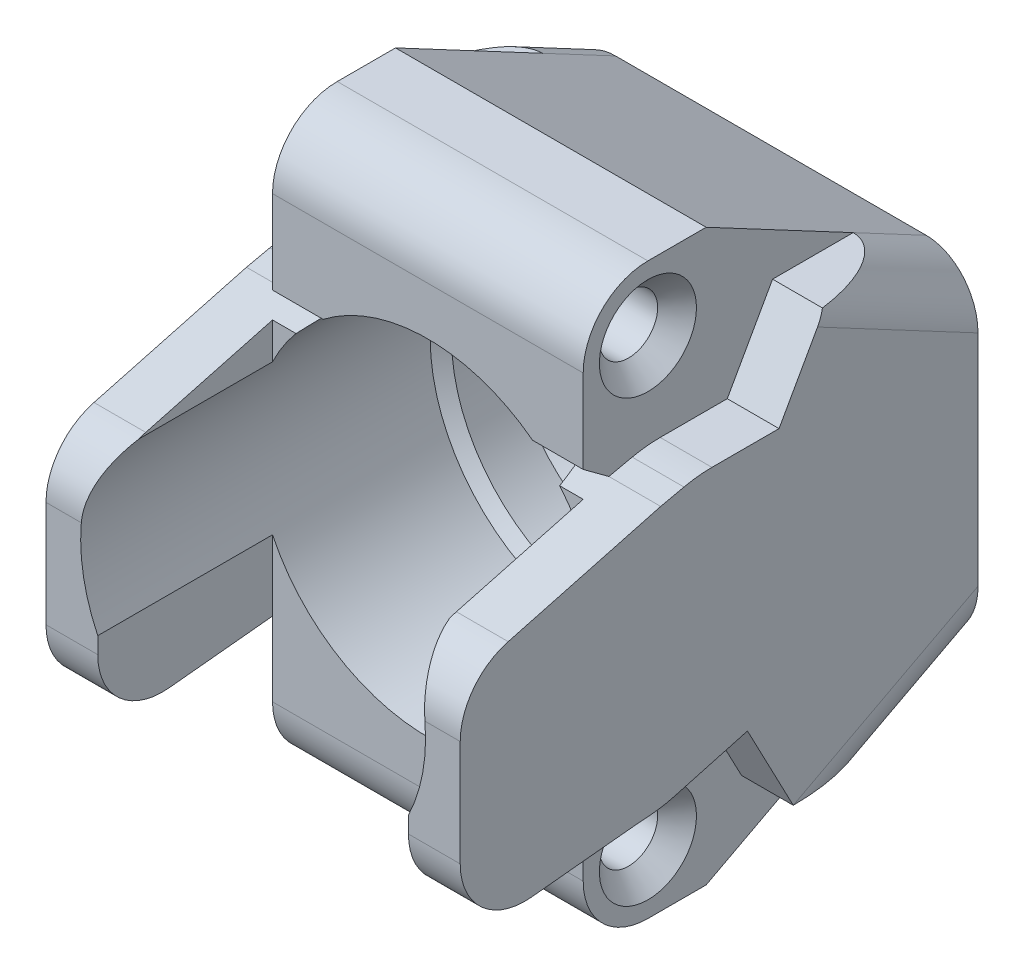
from build123d import *

# Parameters (mm, degrees)
BOSS_EXTRUDE1_DEPTH           = 16
SKETCH2_W                     = 4
SKETCH2_H                     = 6.039060338
CUT_EXTRUDE1_DEPTH            = 49.391321349
FILLET1_R                     = 4
CUT_EXTRUDE2_DEPTH            = 4
SKETCH4_R                     = 12.5
CUT_EXTRUDE3_DEPTH            = 5
SKETCH5_R                     = 11.435
CUT_EXTRUDE4_DEPTH            = 45.34771704
CUT_EXTRUDE5_START            = -2
SKETCH7_R                     = 12.5
CUT_EXTRUDE5_DEPTH            = 43.347717155
CUT_EXTRUDE6_START            = 5
SKETCH8_R                     = 13.322
CUT_EXTRUDE6_DEPTH            = 38.786914196
CHAMFER5_SIZE                 = 1
SKETCH9_W                     = 24
SKETCH9_H                     = 20
CUT_EXTRUDE7_DEPTH            = 59.111966759
CSK_FOR_M4_SFHCS1_D           = 4.5
CSK_FOR_M4_SFHCS1_CSINK_D     = 7.5
CSK_FOR_M4_SFHCS1_CSINK_ANGLE = 90


with BuildPart() as part:
    # Sketch1 → Boss-Extrude1 (new, symmetric)
    with BuildSketch(Plane(origin=(0, 0, 0), x_dir=(0, 0, -1), z_dir=(1, 0, 0))):
        with BuildLine():
            Line((0, 13), (0, -13))
            Line((0, -13), (-17, -21.960950792))
            Line((-17, -21.960950792), (-21.5, -21.960950792))
            ThreePointArc((-21.5, -21.960950792), (-25.035533906, -20.496484698), (-26.5, -16.960950792))
            Line((-26.5, -16.960950792), (-26.5, -11.227190102))
            Line((-26.5, -11.227190102), (-34.5, -12.031216319))
            ThreePointArc((-34.5, -12.031216319), (-38.354100408, -10.76437729), (-39.999997516, -7.056278884))
            Line((-39.999997516, -7.056278884), (-39.999997516, 1.132402994))
            ThreePointArc((-39.999997516, 1.132402994), (-38.966764217, 4.176210139), (-36.294092741, 5.962032125))
            Line((-36.294092741, 5.962032125), (-24.512466398, 9.118909389))
            Line((-24.512466398, 9.118909389), (-26.5, 10.584515032))
            Line((-26.5, 10.584515032), (-26.5, 17.039060338))
            ThreePointArc((-26.5, 17.039060338), (-25.035533906, 20.574594244), (-21.5, 22.039060338))
            Line((-21.5, 22.039060338), (-17, 22.039060338))
            Line((-17, 22.039060338), (0, 13))
        make_face()
    extrude(amount=BOSS_EXTRUDE1_DEPTH, both=True)

    # Sketch2 → Cut-Extrude1 (cut, through all)
    with BuildSketch(Plane(origin=(0, 0, 0), x_dir=(-1, 0, 0), z_dir=(0, 0, -1))):
        with Locations((-14, 19.019530169)):
            Rectangle(SKETCH2_W, SKETCH2_H)
        with Locations((14, 19.019530169)):
            Rectangle(SKETCH2_W, SKETCH2_H)
        with Locations((14, -19.019530169)):
            Rectangle(SKETCH2_W, SKETCH2_H)
        with Locations((-14, -19.019530169)):
            Rectangle(SKETCH2_W, SKETCH2_H)
    extrude(amount=-CUT_EXTRUDE1_DEPTH, mode=Mode.SUBTRACT)

    # Fillet1
    fillet1_edges = [part.edges().sort_by_distance(p)[0] for p in [
        (16, -14.5, 2.845680173),
        (-16, -14.5, 2.845680173),
        (16, 14.5, 2.821089698),
        (-16, 14.5, 2.821089698),
    ]]
    fillet(fillet1_edges, radius=FILLET1_R)

    # Sketch3 → Cut-Extrude2 (cut)
    with BuildSketch(Plane.ZY.offset(16)):
        with BuildLine():
            Line((14.269532395, -16), (17.810147733, -9.256580566))
            Line((17.810147733, -9.256580566), (23.455857772, -10.805790893))
            ThreePointArc((23.455857772, -10.805790893), (24.367969512, -11.010765142), (25.295236814, -11.12966687))
            Line((25.295236814, -11.12966687), (26.5, -11.227190102))
            Line((26.5, -11.227190102), (26.5, -16))
            Line((26.5, -16), (14.269532395, -16))
        make_face()
        with BuildLine():
            Line((11.870259532, 16), (15.370259532, 9.753066737))
            Line((15.370259532, 9.753066737), (20.553734624, 9.753066737))
            ThreePointArc((20.553734624, 9.753066737), (21.64061559, 9.693825703), (22.714618956, 9.516804502))
            Line((22.714618956, 9.516804502), (24.512466398, 9.118909389))
            Line((24.512466398, 9.118909389), (26.5, 10.584515032))
            Line((26.5, 10.584515032), (26.5, 16))
            Line((26.5, 16), (11.870259532, 16))
        make_face()
    cut_extrude2 = extrude(amount=-CUT_EXTRUDE2_DEPTH, mode=Mode.SUBTRACT)

    # Mirror1: Cut-Extrude2 across plane
    add(cut_extrude2.mirror(Plane(origin=(0, 0, 0), x_dir=(0, 0, 1), z_dir=(1, 0, 0))), mode=Mode.SUBTRACT)

    # Sketch4 → Cut-Extrude3 (cut)
    with BuildSketch(Plane(origin=(0, 0, 0), x_dir=(-1, 0, 0), z_dir=(0, 0, -1))):
        with Locations(Location((0, 0, 0), (0, 0, 90))):
            Circle(SKETCH4_R)
    extrude(amount=-CUT_EXTRUDE3_DEPTH, mode=Mode.SUBTRACT)

    # Sketch5 → Cut-Extrude4 (cut, through all)
    with BuildSketch(Plane(origin=(0, 0, 5), x_dir=(-1, 0, 0), z_dir=(0, 0, -1))):
        with Locations(Location((0, 0, 0), (0, 0, 90))):
            Circle(SKETCH5_R)
    extrude(amount=-CUT_EXTRUDE4_DEPTH, mode=Mode.SUBTRACT)

    # Sketch7 → Cut-Extrude5 (cut, through all)
    with BuildSketch(Plane(origin=(0, 0, 5), x_dir=(-1, 0, 0), z_dir=(0, 0, -1)).offset(CUT_EXTRUDE5_START)):
        with Locations(Location((0, 0, 0), (0, 0, 90))):
            Circle(SKETCH7_R)
    extrude(amount=-CUT_EXTRUDE5_DEPTH, mode=Mode.SUBTRACT)

    # Sketch8 → Cut-Extrude6 (cut, through all)
    with BuildSketch(Plane.XY.offset(7).offset(CUT_EXTRUDE6_START)):
        with Locations(Location((0, 0, 0), (0, 0, 175.123832714))):
            Circle(SKETCH8_R)
    extrude(amount=CUT_EXTRUDE6_DEPTH, mode=Mode.SUBTRACT)

    # Chamfer5
    # the kernel refuses this chamfer: 1 mm, written as the material it adds along each edge
    with BuildSketch(Plane(origin=(0, 0, 7), x_dir=(0, 1, 0), z_dir=(-1, 0, 0))) as chamfer5_piece_1:
        Polygon((12.5 - CHAMFER5_SIZE, 0), (12.5, -CHAMFER5_SIZE), (12.5, 0), align=None)
    revolve(axis=Axis((0, 0, 7), (0, 0, -1)))
    with BuildSketch(Plane(origin=(0, 0, 5), x_dir=(0, 1, 0), z_dir=(-1, 0, 0))) as chamfer5_piece_2:
        Polygon((12.5, CHAMFER5_SIZE), (12.5 - CHAMFER5_SIZE, 0), (12.5, 0), align=None)
    revolve(axis=Axis((0, 0, 5), (0, 0, -1)))
    with BuildSketch(Plane(origin=(0, 0, 12), x_dir=(-0.9963807399610061, 0.08500247663896625, 0), z_dir=(0.08500247663896625, 0.9963807399610061, 0))) as chamfer5_piece_3_section:
        Polygon((13.322, CHAMFER5_SIZE), (13.322 - CHAMFER5_SIZE, 0), (13.322, 0), align=None)
    chamfer5_piece_3 = revolve(axis=Axis((0, 0, 12), (0, 0, 1)), mode=Mode.PRIVATE)
    chamfer5_piece_3 = chamfer5_piece_3 - Plane(origin=(0, 0, 12.578358266), x_dir=(0, 1, 0), z_dir=(0, 0, -1)) * Cylinder(12.5, 54, mode=Mode.PRIVATE)
    add(chamfer5_piece_3)

    # Sketch9 → Cut-Extrude7 (cut, through all)
    with BuildSketch(Plane(origin=(0, 17.039060338, 0), x_dir=(-1, 0, 0), z_dir=(0, 1, 0))):
        with Locations((0, 36.5)):
            Rectangle(SKETCH9_W, SKETCH9_H)
    extrude(amount=-CUT_EXTRUDE7_DEPTH, mode=Mode.SUBTRACT)

    # CSK for M4 SFHCS1 (through all)
    with Locations(Plane(origin=(12, 0, 0), x_dir=(0, 0, -1), z_dir=(1, 0, 0))):
        with Locations((-21.5, 17.039060338), (-21.5, -16.960950792)):
            csk_for_m4_sfhcs1 = CounterSinkHole(CSK_FOR_M4_SFHCS1_D / 2, CSK_FOR_M4_SFHCS1_CSINK_D / 2, counter_sink_angle=CSK_FOR_M4_SFHCS1_CSINK_ANGLE)

    # Mirror2: CSK for M4 SFHCS1 across plane
    add(csk_for_m4_sfhcs1.mirror(Plane(origin=(0, 0, 0), x_dir=(0, 0, 1), z_dir=(1, 0, 0))), mode=Mode.SUBTRACT)


solid = part.part
